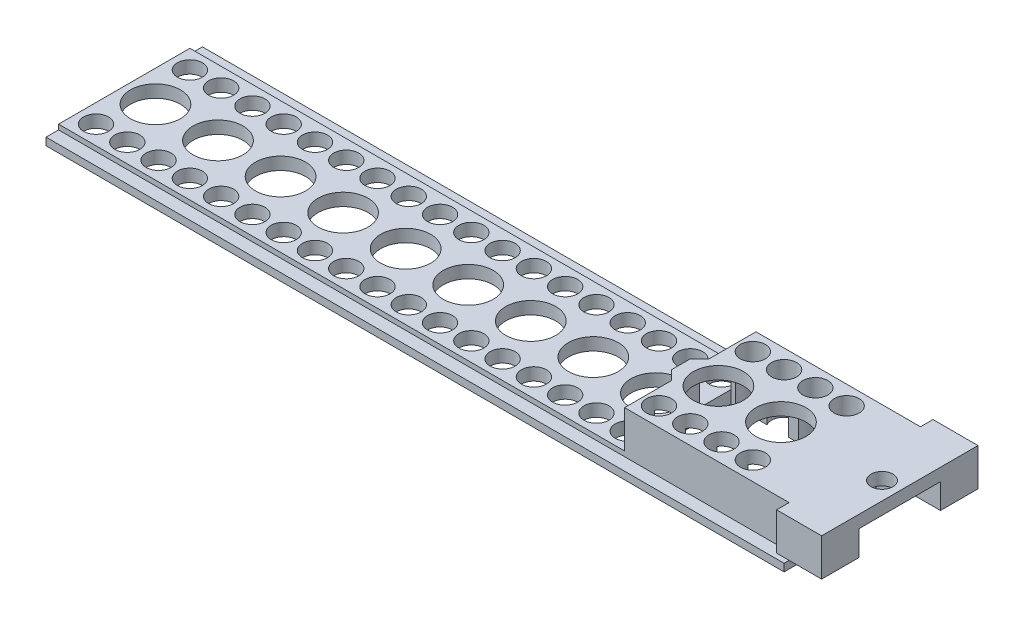
from build123d import *

# Parameters (mm, degrees)
SKIZZE1_W                       = 25
SKIZZE1_H                       = 8
AUFSATZ_LINEAR_AUSTRAGEN1_DEPTH = 124
SKIZZE2_W                       = 2
SKIZZE2_H                       = 6.8
SCHNITT_LINEAR_AUSTRAGEN1_DEPTH = 135.693866119
SKIZZE3_R                       = 1.75
SKIZZE3_W                       = 6
SKIZZE3_H                       = 6
SCHNITT_LINEAR_AUSTRAGEN2_DEPTH = 131.739829541
SKIZZE4_W                       = 4
SKIZZE4_H                       = 6.8
SCHNITT_LINEAR_AUSTRAGEN3_DEPTH = 1.2
SKIZZE5_R                       = 2
SKIZZE5_R_2                     = 4
SCHNITT_LINEAR_AUSTRAGEN4_DEPTH = 131.739829541
LINEARES_MUSTER1_COUNT          = 11
LINEARES_MUSTER1_PITCH          = 10
SKIZZE6_W                       = 90.5
SKIZZE6_H                       = 21
SCHNITT_LINEAR_AUSTRAGEN5_DEPTH = 6
SKIZZE7_W                       = 33.5
SKIZZE7_H                       = 13
SCHNITT_LINEAR_AUSTRAGEN6_DEPTH = 6
SKIZZE8_W                       = 7.2
SKIZZE8_H                       = 6
AUFSATZ_LINEAR_AUSTRAGEN2_DEPTH = 6
AUFSATZ_LINEAR_AUSTRAGEN3_REACH = 132.633
SKIZZE9_W                       = 1.5
SKIZZE9_H                       = 3
FASE1_SIZE                      = 1.5


with BuildPart() as part:
    # Skizze1 → Aufsatz-Linear austragen1 (new body)
    with BuildSketch(Plane(origin=(0, 0, 0), x_dir=(0, 0, -1), z_dir=(1, 0, 0))):
        with Locations((-28.15591013, -29.369664989)):
            Rectangle(SKIZZE1_W, SKIZZE1_H)
    extrude(amount=AUFSATZ_LINEAR_AUSTRAGEN1_DEPTH)

    # Skizze2 → Schnitt-Linear austragen1 (cut, through all)
    with BuildSketch(Plane.ZY):
        with Locations((16.65591013, -28.769664989)):
            Rectangle(SKIZZE2_W, SKIZZE2_H)
        with Locations((39.65591013, -28.769664989)):
            Rectangle(SKIZZE2_W, SKIZZE2_H)
    extrude(amount=-SCHNITT_LINEAR_AUSTRAGEN1_DEPTH, mode=Mode.SUBTRACT)

    # Skizze3 → Schnitt-Linear austragen2 (cut, through all)
    with BuildSketch(Plane(origin=(0, -25.369664989, 0), x_dir=(1, 0, 0), z_dir=(0, 1, 0))):
        with Locations(Location((121.15, -28.15591013, 0), (0, 0, 270))):
            Circle(SKIZZE3_R)
        with Locations((121, -18.65591013)):
            Rectangle(SKIZZE3_W, SKIZZE3_H)
        with Locations((121, -37.65591013)):
            Rectangle(SKIZZE3_W, SKIZZE3_H)
    extrude(amount=-SCHNITT_LINEAR_AUSTRAGEN2_DEPTH, mode=Mode.SUBTRACT)

    # Skizze4 → Schnitt-Linear austragen3 (cut)
    with BuildSketch(Plane(origin=(118, 0, 0), x_dir=(0, 0, -1), z_dir=(1, 0, 0))):
        with Locations((-36.65591013, -28.769664989)):
            Rectangle(SKIZZE4_W, SKIZZE4_H)
        with Locations((-19.65591013, -28.769664989)):
            Rectangle(SKIZZE4_W, SKIZZE4_H)
    extrude(amount=-SCHNITT_LINEAR_AUSTRAGEN3_DEPTH, mode=Mode.SUBTRACT)

    # Skizze5 → Schnitt-Linear austragen4 (cut, through all)
    with BuildSketch(Plane(origin=(0, -25.369664989, 0), x_dir=(1, 0, 0), z_dir=(0, 1, 0))):
        with Locations(Location((3, -20.65591013, 0), (0, 0, 270))):
            Circle(SKIZZE5_R)
        with Locations(Location((5, -28.15591013, 0), (0, 0, 270))):
            Circle(SKIZZE5_R_2)
        with Locations(Location((3, -35.65591013, 0), (0, 0, 270))):
            Circle(SKIZZE5_R)
        with Locations(Location((8, -35.65591013, 0), (0, 0, 270))):
            Circle(SKIZZE5_R)
        with Locations(Location((8, -20.65591013, 0), (0, 0, 270))):
            Circle(SKIZZE5_R)
    schnitt_linear_austragen4 = extrude(amount=-SCHNITT_LINEAR_AUSTRAGEN4_DEPTH, mode=Mode.SUBTRACT)

    # Lineares Muster1: Schnitt-Linear austragen4 ×11
    with Locations(*[(i * LINEARES_MUSTER1_PITCH, 0, 0) for i in range(1, LINEARES_MUSTER1_COUNT)]):
        add(schnitt_linear_austragen4, mode=Mode.SUBTRACT)

    # Skizze6 → Schnitt-Linear austragen5 (cut)
    with BuildSketch(Plane(origin=(0, -25.369664989, 0), x_dir=(1, 0, 0), z_dir=(0, 1, 0))):
        with Locations((45.25, -28.15591013)):
            Rectangle(SKIZZE6_W, SKIZZE6_H)
    extrude(amount=-SCHNITT_LINEAR_AUSTRAGEN5_DEPTH, mode=Mode.SUBTRACT)

    # Skizze7 → Schnitt-Linear austragen6 (cut)
    with BuildSketch(Plane.XZ.offset(33.369664989)):
        with Locations((107.25, 28.15591013)):
            Rectangle(SKIZZE7_W, SKIZZE7_H)
    extrude(amount=-SCHNITT_LINEAR_AUSTRAGEN6_DEPTH, mode=Mode.SUBTRACT)

    # Skizze8 → Aufsatz-Linear austragen2 (add)
    with BuildSketch(Plane(origin=(0, -25.369664989, 0), x_dir=(1, 0, 0), z_dir=(0, 1, 0))):
        with Locations((120.4, -18.65591013)):
            Rectangle(SKIZZE8_W, SKIZZE8_H)
        with Locations((120.4, -37.65591013)):
            Rectangle(SKIZZE8_W, SKIZZE8_H)
    extrude(amount=-AUFSATZ_LINEAR_AUSTRAGEN2_DEPTH)

    # Aufsatz-Linear austragen3: up to this face of the body (flat: up to its plane)
    aufsatz_linear_austragen3_end = Plane(part.part.faces().sort_by_distance((110.417879916, -25.369664989, 28.15591013))[0])
    # Skizze9 → Aufsatz-Linear austragen3 (add, up to the picked face)
    with BuildSketch(Plane(origin=(0, -31.369664989, 0), x_dir=(1, 0, 0), z_dir=(0, 1, 0)), mode=Mode.PRIVATE) as aufsatz_linear_austragen3_sk1:
        with Locations((89.75, -28.15591013)):
            Rectangle(SKIZZE9_W, SKIZZE9_H)
    aufsatz_linear_austragen3_tool1 = split(extrude(aufsatz_linear_austragen3_sk1.sketch, amount=AUFSATZ_LINEAR_AUSTRAGEN3_REACH, mode=Mode.PRIVATE), bisect_by=aufsatz_linear_austragen3_end, keep=Keep.BOTH, mode=Mode.PRIVATE)
    add(aufsatz_linear_austragen3_tool1.solids().sort_by(Axis((89.75, -31.369665, 28.15591), (0, 1, 0)))[0])

    # Fase1
    fase1_edges = [part.edges().sort_by_distance(p)[0] for p in [
        (90.5, -26.369664989, 29.65591013),
        (90.5, -26.369664989, 26.65591013),
    ]]
    chamfer(fase1_edges, length=FASE1_SIZE - 0.0001)  # a hair under: the kernel refuses the full size


solid = part.part
